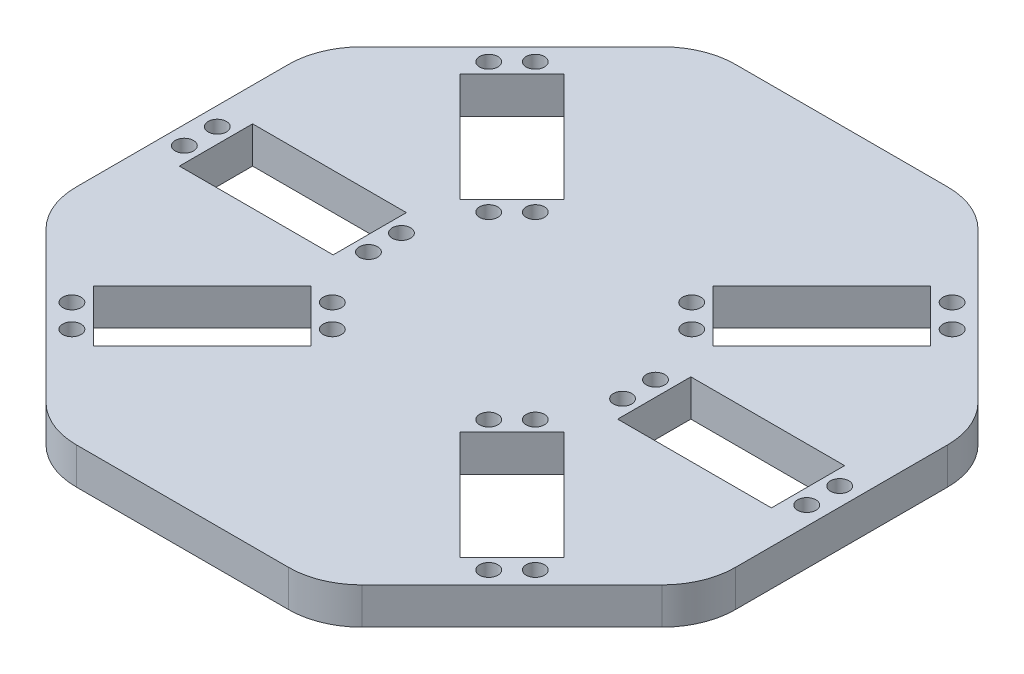
from build123d import *

# Parameters (mm, degrees)
SKETCH1_R           = 2.5
SKETCH1_W           = 42
SKETCH1_H           = 20
BOSS_EXTRUDE1_DEPTH = 10
FILLET1_R           = 20


with BuildPart() as part:
    # Sketch1 → Boss-Extrude1 (new body)
    with BuildSketch(Plane(origin=(0, 0, 0), x_dir=(1, 0, 0), z_dir=(0, 1, 0))):
        Polygon((-90, 37.279220614), (-90, -37.279220614), (-37.279220614, -90), (37.279220614, -90), (90, -37.279220614), (90, 37.279220614), (37.279220614, 90), (-37.279220614, 90), align=None)
        with Locations((21.354624792, -27.718585823)):
            Circle(SKETCH1_R, mode=Mode.SUBTRACT)
        with Locations((27.718585823, -21.354624792)):
            Circle(SKETCH1_R, mode=Mode.SUBTRACT)
        Polygon((34.542166261, -20.400030637), (64.240651071, -50.098515447), (50.098515447, -64.240651071), (20.400030637, -34.542166261), align=None, mode=Mode.SUBTRACT)
        with Locations((-56.922095886, -63.286056916)):
            Circle(SKETCH1_R, mode=Mode.SUBTRACT)
        with Locations((-63.286056916, -56.922095886)):
            Circle(SKETCH1_R, mode=Mode.SUBTRACT)
        with Locations((-85, -4.5)):
            Circle(SKETCH1_R, mode=Mode.SUBTRACT)
        Polygon((-34.542166261, -20.400030637), (-20.400030637, -34.542166261), (-50.098515447, -64.240651071), (-64.240651071, -50.098515447), align=None, mode=Mode.SUBTRACT)
        with Locations((-21.354624792, -27.718585823)):
            Circle(SKETCH1_R, mode=Mode.SUBTRACT)
        with Locations((-27.718585823, -21.354624792)):
            Circle(SKETCH1_R, mode=Mode.SUBTRACT)
        with Locations((-34.7, -4.5)):
            Circle(SKETCH1_R, mode=Mode.SUBTRACT)
        with Locations((56.922095886, -63.286056916)):
            Circle(SKETCH1_R, mode=Mode.SUBTRACT)
        with Locations((63.286056916, -56.922095886)):
            Circle(SKETCH1_R, mode=Mode.SUBTRACT)
        with Locations((63.286056916, 56.922095886)):
            Circle(SKETCH1_R, mode=Mode.SUBTRACT)
        with Locations((56.922095886, 63.286056916)):
            Circle(SKETCH1_R, mode=Mode.SUBTRACT)
        with Locations((34.7, -4.5)):
            Circle(SKETCH1_R, mode=Mode.SUBTRACT)
        with Locations((85, -4.5)):
            Circle(SKETCH1_R, mode=Mode.SUBTRACT)
        with Locations((-85, 4.5)):
            Circle(SKETCH1_R, mode=Mode.SUBTRACT)
        with Locations((-59.85, 0)):
            Rectangle(SKETCH1_W, SKETCH1_H, mode=Mode.SUBTRACT)
        with Locations((-34.7, 4.5)):
            Circle(SKETCH1_R, mode=Mode.SUBTRACT)
        with Locations((-27.718585823, 21.354624792)):
            Circle(SKETCH1_R, mode=Mode.SUBTRACT)
        Polygon((-20.400030637, 34.542166261), (-34.542166261, 20.400030637), (-64.240651071, 50.098515447), (-50.098515447, 64.240651071), align=None, mode=Mode.SUBTRACT)
        with Locations((-21.354624792, 27.718585823)):
            Circle(SKETCH1_R, mode=Mode.SUBTRACT)
        with Locations((-63.286056916, 56.922095886)):
            Circle(SKETCH1_R, mode=Mode.SUBTRACT)
        with Locations((-56.922095886, 63.286056916)):
            Circle(SKETCH1_R, mode=Mode.SUBTRACT)
        with Locations((34.7, 4.5)):
            Circle(SKETCH1_R, mode=Mode.SUBTRACT)
        with Locations((27.718585823, 21.354624792)):
            Circle(SKETCH1_R, mode=Mode.SUBTRACT)
        with Locations((21.354624792, 27.718585823)):
            Circle(SKETCH1_R, mode=Mode.SUBTRACT)
        Polygon((34.542166261, 20.400030637), (20.400030637, 34.542166261), (50.098515447, 64.240651071), (64.240651071, 50.098515447), align=None, mode=Mode.SUBTRACT)
        with Locations((59.85, 0)):
            Rectangle(SKETCH1_W, SKETCH1_H, mode=Mode.SUBTRACT)
        with Locations((85, 4.5)):
            Circle(SKETCH1_R, mode=Mode.SUBTRACT)
    extrude(amount=BOSS_EXTRUDE1_DEPTH)

    # Fillet1
    fillet1_edges = [part.edges().sort_by_distance(p)[0] for p in [
        (-90, 5, -37.279220614),
        (-37.279220614, 5, -90),
        (37.279220614, 5, -90),
        (90, 5, -37.279220614),
        (90, 5, 37.279220614),
        (37.279220614, 5, 90),
        (-37.279220614, 5, 90),
        (-90, 5, 37.279220614),
    ]]
    fillet(fillet1_edges, radius=FILLET1_R)


solid = part.part
